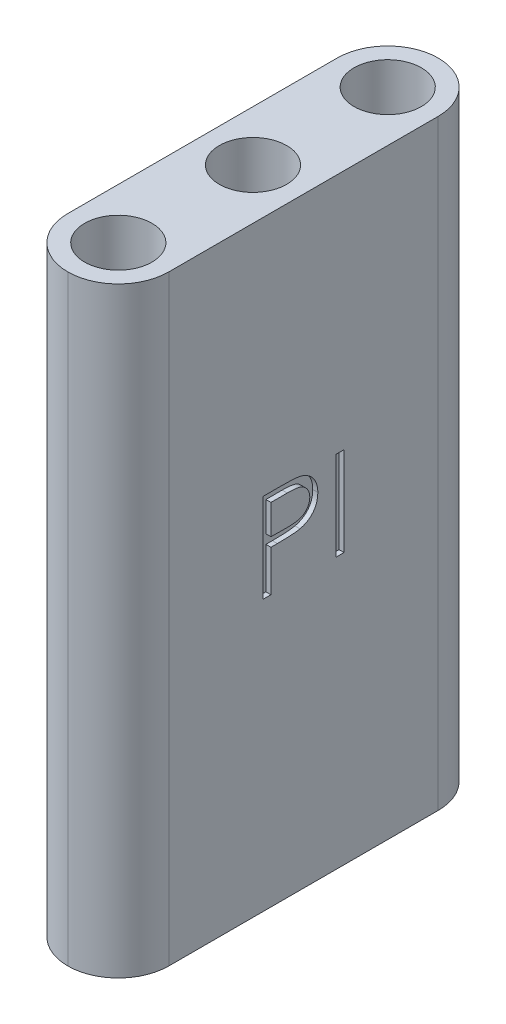
from build123d import *

# Parameters (mm, degrees)
SKETCH1_W           = 6
SKETCH1_H           = 22
SKETCH1_R           = 2
BOSS_EXTRUDE1_DEPTH = 35.7
FILLET1_R           = 3
SKETCH2_W           = 0.474893162
SKETCH2_H           = 5.291666667
CUT_EXTRUDE1_DEPTH  = 0.3


with BuildPart() as part:
    # Sketch1 → Boss-Extrude1 (new body)
    with BuildSketch(Plane(origin=(0, 0, 0), x_dir=(1, 0, 0), z_dir=(0, 1, 0))):
        with Locations((3, -11)):
            Rectangle(SKETCH1_W, SKETCH1_H)
        with Locations(Location((3, -11, 0), (0, 0, 90))):
            Circle(SKETCH1_R, mode=Mode.SUBTRACT)
        with Locations(Location((3, -19, 0), (0, 0, 90))):
            Circle(SKETCH1_R, mode=Mode.SUBTRACT)
        with Locations(Location((3, -3, 0), (0, 0, 90))):
            Circle(SKETCH1_R, mode=Mode.SUBTRACT)
    extrude(amount=BOSS_EXTRUDE1_DEPTH)

    # Fillet1
    fillet1_edges = [part.edges().sort_by_distance(p)[0] for p in [
        (0, 17.85, 0),
        (6, 17.85, 0),
        (0, 17.85, 22),
        (6, 17.85, 22),
    ]]
    fillet(fillet1_edges, radius=FILLET1_R - 0.0001)  # a hair under: the kernel refuses the full size

    # Sketch2 → Cut-Extrude1 (cut)
    # profile 1 of 2: a face of its own
    with BuildSketch(Plane(origin=(6, 0, 0), x_dir=(0, 0, -1), z_dir=(1, 0, 0))):
        with BuildLine():
            Line((-13.408386752, 21.352777778), (-12.370617989, 21.352777778))
            add(Edge.make_bspline(
                [(-12.370617989, 21.352777778), (-12.299239595, 21.352699316), (-12.162475422, 21.352548979), (-11.966358612, 21.34799097), (-11.788241518, 21.341902995), (-11.628508204, 21.333463704), (-11.486667198, 21.323490288), (-11.363360329, 21.309502086), (-11.257618381, 21.294896639), (-11.19425982, 21.280047607), (-11.165364583, 21.273275574)],
                knots=[0, 0, 0, 0, 1.415646017, 2.712440637, 3.8905458, 4.950247383, 5.884950622, 6.709939814, 7.411656543, 8, 8, 8, 8], degree=3))
            add(Edge.make_bspline(
                [(-11.165364583, 21.273275574), (-11.128786264, 21.263263817), (-11.056491549, 21.243476216), (-10.952319734, 21.203843563), (-10.853208563, 21.156850289), (-10.758817992, 21.103292666), (-10.670307938, 21.040872825), (-10.586357852, 20.972121046), (-10.507708596, 20.895449984), (-10.434802444, 20.81171958), (-10.367848048, 20.722335453), (-10.310199599, 20.625963272), (-10.261928672, 20.52422523), (-10.220527774, 20.417192092), (-10.190730468, 20.303965056), (-10.168283369, 20.18533086), (-10.154035742, 20.061302221), (-10.152671154, 19.97654504), (-10.151976496, 19.933398438)],
                knots=[0, 0, 0, 0, 0.999701418, 1.975846123, 2.934577507, 3.890451536, 4.834027766, 5.787354733, 6.749476667, 7.726910423, 8.712836071, 9.690891519, 10.682875813, 11.679750201, 12.712814741, 13.765529915, 14.8625177, 16, 16, 16, 16], degree=3))
            add(Edge.make_bspline(
                [(-10.151976496, 19.933398438), (-10.15261365, 19.88988918), (-10.153860285, 19.804760378), (-10.168822526, 19.680220568), (-10.188976506, 19.561205859), (-10.219966097, 19.447980142), (-10.260554198, 19.341215822), (-10.308167182, 19.239281341), (-10.365594663, 19.143910884), (-10.431581489, 19.054758218), (-10.504986876, 18.97173966), (-10.585500246, 18.895456816), (-10.672796558, 18.82635621), (-10.766598377, 18.764282928), (-10.867820172, 18.71067641), (-10.974926761, 18.66266239), (-11.088849112, 18.622338286), (-11.167683628, 18.601126169), (-11.207765759, 18.590341213)],
                knots=[0, 0, 0, 0, 1.121902311, 2.195077645, 3.232258892, 4.234102512, 5.217864754, 6.176164875, 7.132989551, 8.084763148, 9.034132444, 9.988522005, 10.94243251, 11.903244335, 12.886203696, 13.894208494, 14.929344452, 16, 16, 16, 16], degree=3))
            add(Edge.make_bspline(
                [(-11.207765759, 18.590341213), (-11.240917799, 18.583291229), (-11.313572424, 18.567840781), (-11.433228682, 18.550592281), (-11.57254373, 18.535869956), (-11.731327415, 18.524831331), (-11.909437212, 18.515381369), (-12.10696947, 18.507870085), (-12.324311944, 18.503742806), (-12.475912515, 18.50352994), (-12.555063101, 18.503418803)],
                knots=[0, 0, 0, 0, 0.601384939, 1.31797006, 2.144135048, 3.087295005, 4.142315834, 5.309527816, 6.595305764, 8, 8, 8, 8], degree=3))
            Line((-12.555063101, 18.503418803), (-12.93349359, 18.503418803))
            Line((-12.93349359, 18.503418803), (-12.93349359, 16.061111111))
            Line((-12.93349359, 16.061111111), (-13.408386752, 16.061111111))
            Line((-13.408386752, 16.061111111), (-13.408386752, 21.352777778))
        make_face()
        with BuildLine():
            Line((-12.93349359, 20.810042735), (-12.93349359, 19.046153846))
            Line((-12.93349359, 19.046153846), (-12.007027911, 19.034493523))
            add(Edge.make_bspline(
                [(-12.007027911, 19.034493523), (-11.961791833, 19.034470143), (-11.874464516, 19.03442501), (-11.748316893, 19.040450288), (-11.631281423, 19.047405855), (-11.523717601, 19.05758993), (-11.425576938, 19.071985165), (-11.336695793, 19.086517197), (-11.257763354, 19.107540781), (-11.165387179, 19.135848278), (-11.062451642, 19.184127352), (-10.950468563, 19.254203972), (-10.855565414, 19.343528376), (-10.773441323, 19.44396093), (-10.708269341, 19.555689376), (-10.660559686, 19.675234078), (-10.632527222, 19.801369041), (-10.628768334, 19.88768087), (-10.626869658, 19.931278379)],
                knots=[0, 0, 0, 0, 1.160613943, 2.240541288, 3.23993089, 4.169200891, 5.011653406, 5.7853311, 6.478053781, 7.106038997, 8.262395093, 9.384106736, 10.481365981, 11.59014053, 12.70357646, 13.786202915, 14.881775077, 16, 16, 16, 16], degree=3))
            add(Edge.make_bspline(
                [(-10.626869658, 19.931278379), (-10.628778659, 19.973821131), (-10.632573518, 20.058390858), (-10.660779406, 20.182334936), (-10.708176583, 20.30061987), (-10.773878815, 20.410948226), (-10.853618381, 20.511019393), (-10.946297149, 20.597949574), (-11.051696961, 20.667832386), (-11.14974131, 20.712937467), (-11.236828818, 20.740477228), (-11.312472376, 20.759746213), (-11.397880896, 20.775130761), (-11.493082182, 20.787588104), (-11.597338347, 20.798252266), (-11.711545085, 20.805488208), (-11.83526976, 20.809723743), (-11.921161933, 20.80993383), (-11.965686765, 20.810042735)],
                knots=[0, 0, 0, 0, 1.120700087, 2.227813068, 3.331159281, 4.466773991, 5.599788987, 6.693661531, 7.80175334, 8.91857717, 9.525282508, 10.207424825, 10.974604443, 11.810962634, 12.737642355, 13.736264703, 14.826523623, 16, 16, 16, 16], degree=3))
            Line((-11.965686765, 20.810042735), (-12.93349359, 20.810042735))
        make_face(mode=Mode.SUBTRACT)
    # profile 2 of 2: a face of its own
    with BuildSketch(Plane(origin=(6, 0, 0), x_dir=(0, 0, -1), z_dir=(1, 0, 0))):
        with Locations((-8.829059829, 18.706944445)):
            Rectangle(SKETCH2_W, SKETCH2_H)
    extrude(amount=-CUT_EXTRUDE1_DEPTH, mode=Mode.SUBTRACT)


solid = part.part
